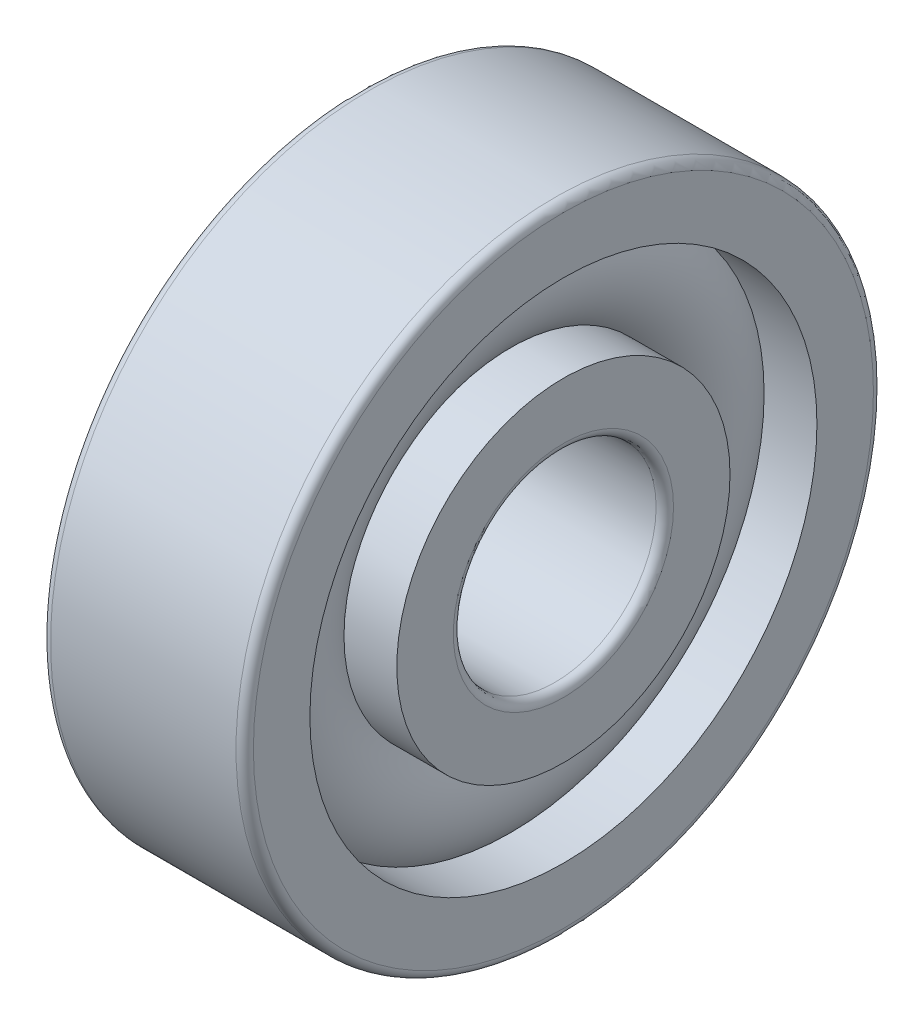
from build123d import *

# Parameters (mm, degrees)
CAGSPISKE_W     = 0.45
CAGSPISKE_H     = 0.75
CAGESPINE_ANGLE = 0.001
BALSIMSKE_R     = 2.25


with BuildPart() as part:
    # CagSpiSke → CageSpine (revolve)
    with BuildSketch(Plane.XY):
        with Locations((0, 7.25)):
            Rectangle(CAGSPISKE_W, CAGSPISKE_H)
    revolve(axis=Axis((-20.6375, 0, 0), (-1, 0, 0)), revolution_arc=CAGESPINE_ANGLE)

    # BalSimSke → BallsSimplified (revolve)
    with BuildSketch(Plane.XY):
        with Locations((0, 7.25)):
            Circle(BALSIMSKE_R)
    revolve(axis=Axis((-10, 0, 0), (1, 0, 0)))

    # InnRacSke → InnerRace (revolve)
    with BuildSketch(Plane.XY):
        with BuildLine():
            Line((-1.643357843, 5.75), (-3.5, 5.75))
            Line((-3.5, 5.75), (-3.5, 3.8))
            ThreePointArc((-3.5, 3.8), (-3.412132034, 3.587867966), (-3.2, 3.5))
            Line((-3.2, 3.5), (3.2, 3.5))
            ThreePointArc((3.2, 3.5), (3.412132034, 3.587867966), (3.5, 3.8))
            Line((3.5, 3.8), (3.5, 5.75))
            Line((3.5, 5.75), (1.643357843, 5.75))
            ThreePointArc((1.643357843, 5.75), (0, 5.025), (-1.643357843, 5.75))
        make_face()
    revolve(axis=Axis((-20.6375, 0, 0), (1, 0, 0)))

    # OutRacSke → OuterRace (revolve)
    with BuildSketch(Plane.XY):
        with BuildLine():
            Line((-1.643357843, 8.75), (-3.5, 8.75))
            Line((-3.5, 8.75), (-3.5, 10.7))
            ThreePointArc((-3.5, 10.7), (-3.412132034, 10.912132034), (-3.2, 11))
            Line((-3.2, 11), (3.2, 11))
            ThreePointArc((3.2, 11), (3.412132034, 10.912132034), (3.5, 10.7))
            Line((3.5, 10.7), (3.5, 8.75))
            Line((3.5, 8.75), (1.643357843, 8.75))
            ThreePointArc((1.643357843, 8.75), (0, 9.475), (-1.643357843, 8.75))
        make_face()
    revolve(axis=Axis((-20.6375, 0, 0), (1, 0, 0)))


solid = part.part
